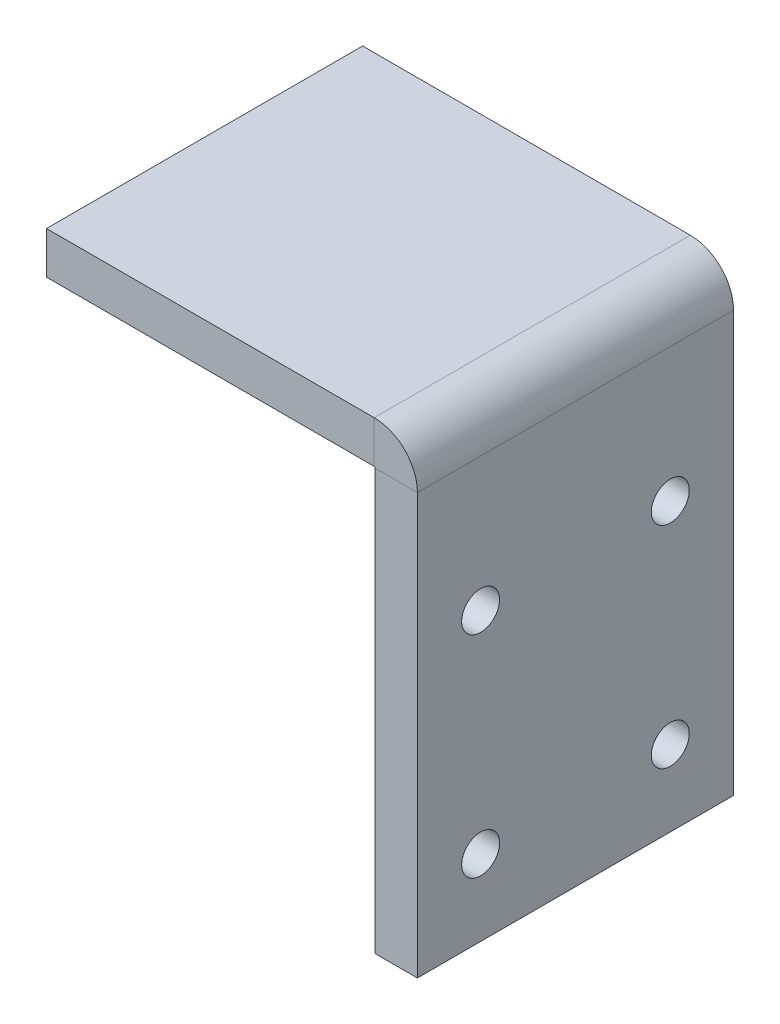
from build123d import *

# Parameters (mm, degrees)
BASE_FLANGE1_DEPTH = 75
SKETCH6_R          = 4.5
CUT_EXTRUDE1_DEPTH = 160.590099944


# Sheet-metal steps are written as plain solids
with BuildPart() as part:
    # Sketch1 → Base-Flange1 (new body)
    with BuildSketch(Plane.XY):
        with BuildLine():
            Line((0, 0), (0, 99.75))
            ThreePointArc((0, 99.75), (-0.073223305, 99.926776695), (-0.25, 100))
            Line((-0.25, 100), (-78, 100))
            Line((-78, 100), (-78, 110))
            Line((-78, 110), (-0.25, 110))
            ThreePointArc((-0.25, 110), (6.997844507, 106.997844507), (10, 99.75))
            Line((10, 99.75), (10, 0))
            Line((10, 0), (0, 0))
        make_face()
    extrude(amount=BASE_FLANGE1_DEPTH)

    # Sketch6 → Cut-Extrude1 (cut, through all)
    with BuildSketch(Plane(origin=(10, 0, 0), x_dir=(0, 0, -1), z_dir=(1, 0, 0))):
        with Locations((-60, 18)):
            Circle(SKETCH6_R)
        with Locations((-15, 18)):
            Circle(SKETCH6_R)
        with Locations((-60, 68)):
            Circle(SKETCH6_R)
        with Locations((-15, 68)):
            Circle(SKETCH6_R)
    extrude(amount=-CUT_EXTRUDE1_DEPTH, mode=Mode.SUBTRACT)


solid = part.part
